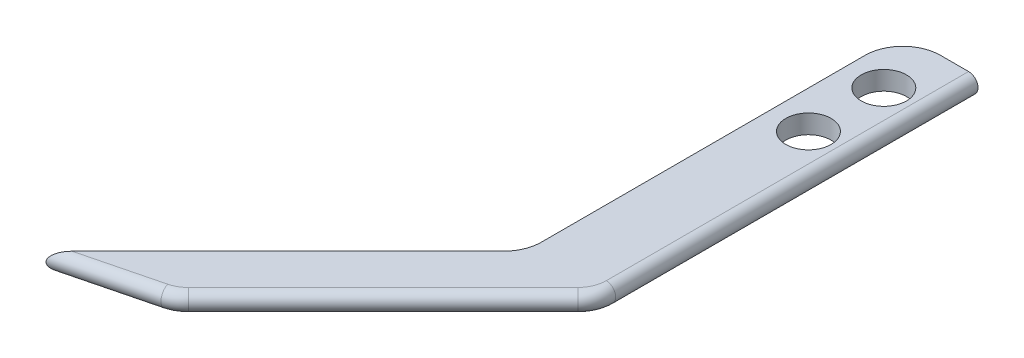
from build123d import *

# Parameters (mm, degrees)
EXTRUDE_2_DEPTH     = 5
SKETCH_5_R          = 6
CUT_EXTRUDE_2_DEPTH = 15
FILLET_1_R          = 10
FILLET_2_R          = 10
FILLET_3_R          = 10
FILLET_6_R          = 10
FILLET_8_R          = 2.5


with BuildPart() as part:
    # 草图2 → 凸台-拉伸2 (new body)
    with BuildSketch(Plane(origin=(0, 0, 0), x_dir=(1, 0, 0), z_dir=(0, 1, 0))):
        Polygon((0, 0), (19.954469714, 0), (19.954469714, -100.254623121), (-36.614072781, -156.823165616), (-63.639610307, -163.639610307), (0, -100), align=None)
    extrude(amount=EXTRUDE_2_DEPTH)

    # 草图5 → 切除-拉伸2 (cut)
    with BuildSketch(Plane(origin=(0, 5, 0), x_dir=(1, 0, 0), z_dir=(0, 1, 0))):
        with Locations(Location((9.977234857, -15, 0), (0, 0, 270))):
            Circle(SKETCH_5_R)
        with Locations(Location((9.977234857, -35, 0), (0, 0, 270))):
            Circle(SKETCH_5_R)
    extrude(amount=-CUT_EXTRUDE_2_DEPTH, mode=Mode.SUBTRACT)

    # 圆角1
    fillet_1_edges = [part.edges().sort_by_distance(p)[0] for p in [
        (0, 2.5, 100),
    ]]
    fillet(fillet_1_edges, radius=FILLET_1_R)

    # 圆角2
    fillet_2_edges = [part.edges().sort_by_distance(p)[0] for p in [
        (19.954469714, 2.5, 100.254623121),
    ]]
    fillet(fillet_2_edges, radius=FILLET_2_R)

    # 圆角3
    fillet_3_edges = [part.edges().sort_by_distance(p)[0] for p in [
        (-36.614072781, 2.5, 156.823165616),
    ]]
    fillet(fillet_3_edges, radius=FILLET_3_R)

    # 圆角6
    fillet_6_edges = [part.edges().sort_by_distance(p)[0] for p in [
        (0, 2.5, 0),
    ]]
    fillet(fillet_6_edges, radius=FILLET_6_R)

    # 圆角8
    fillet_8_edges = [part.edges().sort_by_distance(p)[0] for p in [
        (-51.464251164, 5, 160.568712564),
        (19.954469714, 0, 48.056243749),
        (19.954469714, 5, 48.056243749),
        (19.193265039, 5, 99.939321821),
        (-8.818959374, 0, 129.02805221),
        (-8.818959374, 5, 129.02805221),
        (-36.79844273, 5, 156.498325602),
        (-51.464251164, 0, 160.568712564),
    ]]
    fillet(fillet_8_edges, radius=FILLET_8_R - 0.0001)  # a hair under: the kernel refuses the full size


solid = part.part
